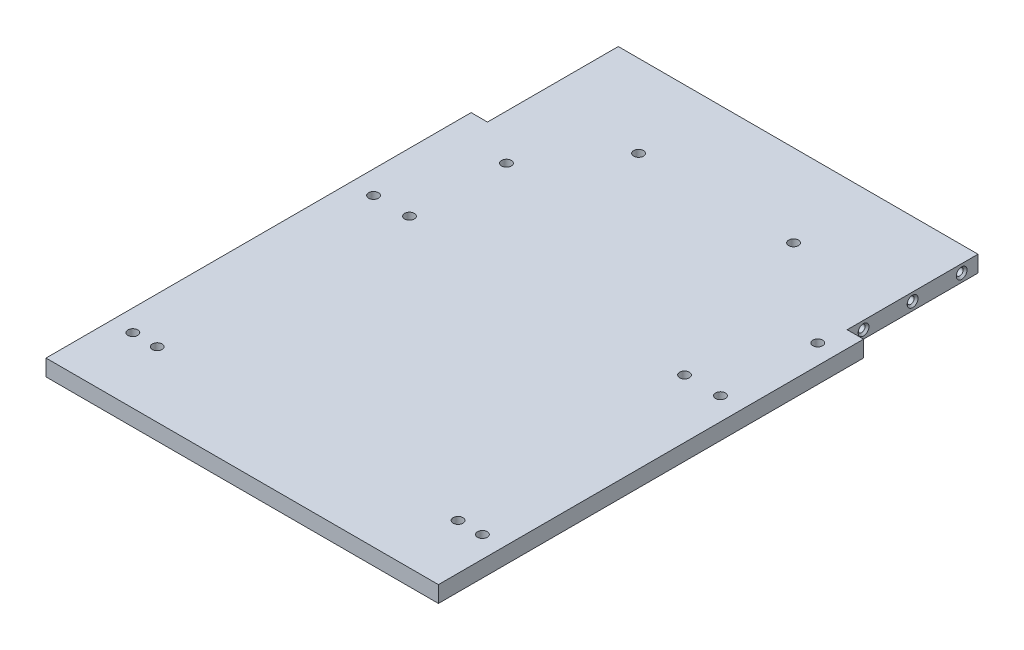
from build123d import *

# Parameters (mm, degrees)
BOSS_EXTRUDE1_DEPTH             = 6.35
F_6_32_TAPPED_HOLE1_D           = 2.7051
F_6_32_TAPPED_HOLE1_DEPTH       = 11.88730597
F_6_32_TAPPED_HOLE1_CSINK_D     = 4.20116
F_6_32_TAPPED_HOLE1_CSINK_ANGLE = 90
F_6_32_TAPPED_HOLE1_TIP         = 0.81269403
F_6_32_TAPPED_HOLE2_D           = 2.7051
F_6_32_TAPPED_HOLE2_DEPTH       = 11.88730597
F_6_32_TAPPED_HOLE2_CSINK_D     = 4.20116
F_6_32_TAPPED_HOLE2_CSINK_ANGLE = 90
F_6_32_TAPPED_HOLE2_TIP         = 0.81269403
SKETCH25_R                      = 1.89865
CUT_EXTRUDE1_DEPTH              = 265.346160366
SKETCH20_R                      = 1.89865
CUT_EXTRUDE2_DEPTH              = 265.346160366
SKETCH16_R                      = 1.89865
CUT_EXTRUDE3_DEPTH              = 265.346160366
SKETCH9_R                       = 1.89865
CUT_EXTRUDE4_DEPTH              = 265.346160366


with BuildPart() as part:
    # Sketch1 → Boss-Extrude1 (new body)
    with BuildSketch(Plane(origin=(0, 0, 0), x_dir=(1, 0, 0), z_dir=(0, 1, 0))):
        Polygon((-6.35, 0), (-6.35, -50.8), (0, -50.8), (0, -215.9), (-152.4, -215.9), (-152.4, -50.8), (-146.05, -50.8), (-146.05, 0), align=None)
    extrude(amount=BOSS_EXTRUDE1_DEPTH)

    # #6-32 Tapped Hole1
    with Locations(Plane(origin=(-6.35, 0, 0), x_dir=(0, 0, -1), z_dir=(1, 0, 0))):
        with Locations((-44.45, 3.175), (-25.4, 3.175), (-6.35, 3.175)):
            CounterSinkHole(F_6_32_TAPPED_HOLE1_D / 2, F_6_32_TAPPED_HOLE1_CSINK_D / 2, depth=F_6_32_TAPPED_HOLE1_DEPTH, counter_sink_angle=F_6_32_TAPPED_HOLE1_CSINK_ANGLE)
            with Locations((0, 0, -(F_6_32_TAPPED_HOLE1_DEPTH + F_6_32_TAPPED_HOLE1_TIP / 2))):  # 118° drill point
                Cone(0, F_6_32_TAPPED_HOLE1_D / 2, F_6_32_TAPPED_HOLE1_TIP, mode=Mode.SUBTRACT)

    # #6-32 Tapped Hole2
    with Locations(Plane.ZY.offset(146.05)):
        with Locations((6.35, 3.175), (25.4, 3.175), (44.45, 3.175)):
            CounterSinkHole(F_6_32_TAPPED_HOLE2_D / 2, F_6_32_TAPPED_HOLE2_CSINK_D / 2, depth=F_6_32_TAPPED_HOLE2_DEPTH, counter_sink_angle=F_6_32_TAPPED_HOLE2_CSINK_ANGLE)
            with Locations((0, 0, -(F_6_32_TAPPED_HOLE2_DEPTH + F_6_32_TAPPED_HOLE2_TIP / 2))):  # 118° drill point
                Cone(0, F_6_32_TAPPED_HOLE2_D / 2, F_6_32_TAPPED_HOLE2_TIP, mode=Mode.SUBTRACT)

    # Sketch25 → Cut-Extrude1 (cut, through all)
    with BuildSketch(Plane(origin=(0, 6.35, 0), x_dir=(1, 0, 0), z_dir=(0, 1, 0))):
        with Locations((-8.32612, -190.5)):
            Circle(SKETCH25_R)
        with Locations((-17.78, -190.5)):
            Circle(SKETCH25_R)
    extrude(amount=-CUT_EXTRUDE1_DEPTH, mode=Mode.SUBTRACT)

    # Sketch20 → Cut-Extrude2 (cut, through all)
    with BuildSketch(Plane(origin=(0, 6.35, 0), x_dir=(1, 0, 0), z_dir=(0, 1, 0))):
        with Locations((-128.524, -60.96)):
            Circle(SKETCH20_R)
        with Locations((-129.54, -97.59811552)):
            Circle(SKETCH20_R)
        with Locations((-143.4846, -97.6122)):
            Circle(SKETCH20_R)
        with Locations((-7.62, -60.96)):
            Circle(SKETCH20_R)
        with Locations((-22.7076, -97.6122)):
            Circle(SKETCH20_R)
        with Locations((-8.763, -97.6122)):
            Circle(SKETCH20_R)
    extrude(amount=-CUT_EXTRUDE2_DEPTH, mode=Mode.SUBTRACT)

    # Sketch16 → Cut-Extrude3 (cut, through all)
    with BuildSketch(Plane(origin=(0, 6.35, 0), x_dir=(1, 0, 0), z_dir=(0, 1, 0))):
        with Locations((-45.974, -32.004)):
            Circle(SKETCH16_R)
        with Locations((-106.172, -32.004)):
            Circle(SKETCH16_R)
    extrude(amount=-CUT_EXTRUDE3_DEPTH, mode=Mode.SUBTRACT)

    # Sketch9 → Cut-Extrude4 (cut, through all)
    with BuildSketch(Plane(origin=(0, 6.35, 0), x_dir=(1, 0, 0), z_dir=(0, 1, 0))):
        with Locations((-134.62, -190.5)):
            Circle(SKETCH9_R)
        with Locations((-144.07388, -190.5)):
            Circle(SKETCH9_R)
    extrude(amount=-CUT_EXTRUDE4_DEPTH, mode=Mode.SUBTRACT)


solid = part.part
